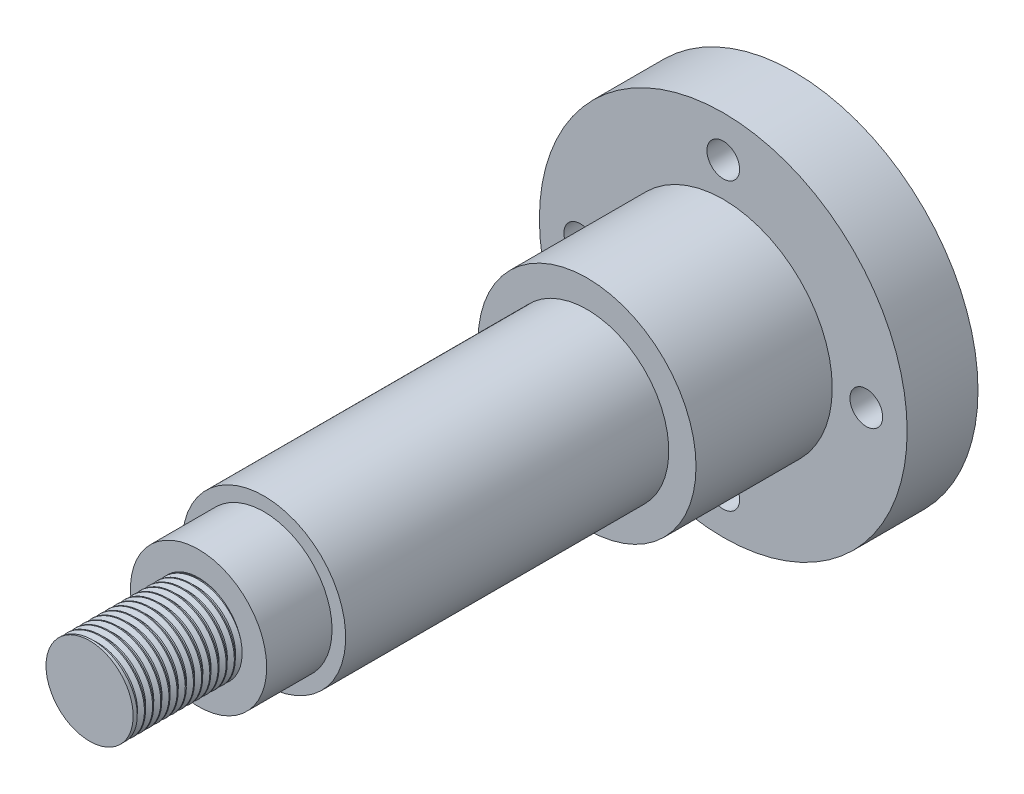
from build123d import *

# Parameters (mm, degrees)
BOSS_EXTRUDE1_DEPTH      = 10
BOSS_EXTRUDE1_DEPTH_BACK = 3
SKETCH3_R                = 33.75
SKETCH4_R                = 20
BOSS_EXTRUDE2_DEPTH      = 25
SKETCH5_R                = 15
BOSS_EXTRUDE3_DEPTH      = 59.3
SKETCH6_R                = 12.5
BOSS_EXTRUDE4_DEPTH      = 12
SKETCH7_R                = 3
CUT_EXTRUDE1_DEPTH       = 40
SKETCH8_R                = 8
BOSS_EXTRUDE5_DEPTH      = 20
THREAD1_PITCH            = 1.5


with BuildPart() as part:
    # Sketch3 → Boss-Extrude1 (new, two sides: drawn at the far end of the back side and taken through both)
    with BuildSketch(Plane.XY.offset(-BOSS_EXTRUDE1_DEPTH_BACK)):
        Circle(SKETCH3_R)
    extrude(amount=BOSS_EXTRUDE1_DEPTH + BOSS_EXTRUDE1_DEPTH_BACK)

    # Sketch4 → Boss-Extrude2 (add)
    with BuildSketch(Plane.XY.offset(10)):
        Circle(SKETCH4_R)
    extrude(amount=BOSS_EXTRUDE2_DEPTH)

    # Sketch5 → Boss-Extrude3 (add)
    with BuildSketch(Plane.XY.offset(35)):
        with Locations(Location((0, 0, 0), (0, 0, 180))):
            Circle(SKETCH5_R)
    extrude(amount=BOSS_EXTRUDE3_DEPTH)

    # Sketch6 → Boss-Extrude4 (add)
    with BuildSketch(Plane.XY.offset(94.3)):
        Circle(SKETCH6_R)
    extrude(amount=BOSS_EXTRUDE4_DEPTH)

    # Sketch7 → Cut-Extrude1 (cut)
    with BuildSketch(Plane.XY.offset(10)):
        with Locations((0, 26.25)):
            Circle(SKETCH7_R)
        with Locations((26.25, 0)):
            Circle(SKETCH7_R)
        with Locations((0, -26.25)):
            Circle(SKETCH7_R)
        with Locations((-26.25, 0)):
            Circle(SKETCH7_R)
    extrude(amount=-CUT_EXTRUDE1_DEPTH, mode=Mode.SUBTRACT)

    # Sketch8 → Boss-Extrude5 (add)
    with BuildSketch(Plane.XY.offset(106.3)):
        Circle(SKETCH8_R)
    extrude(amount=BOSS_EXTRUDE5_DEPTH)

    # Thread1: the profile of Thread Profile1 profile screwed along a right-hand helix of 13.333333 turns, 8 arcs to a turn; built about Z, then put on its axis
    thread1_z = Axis((0, 0, 0), (0, 0, 1))
    thread1_corners = [(8.0003, 0, -0.000173205), (8.0003, 0, 1.312673201), (7.188101188, 0, 0.843749998), (7.188101188, 0, 0.468749998)]
    with BuildLine(mode=Mode.PRIVATE) as thread1_profile:
        Line(thread1_corners[0], thread1_corners[1])
        Line(thread1_corners[1], thread1_corners[2])
        Line(thread1_corners[2], thread1_corners[3])
        Line(thread1_corners[3], thread1_corners[0])
    thread1_cap = Face(thread1_profile.wire())
    thread1_turn_angles = [0, 22.5, 45, 67.5, 90, 112.5, 135, 157.5, 180, 202.5, 225, 247.5, 270, 292.5, 315, 337.5, 360]
    thread1_turn_weights = [1, 0.9238795325112867, 1, 0.9238795325112867, 1, 0.9238795325112867, 1, 0.9238795325112867, 1, 0.9238795325112867, 1, 0.9238795325112867, 1, 0.9238795325112867, 1, 0.9238795325112867, 1]
    thread1_turn_rails = [Edge.make_bspline([Vector(p[0], p[1], 0).rotate(thread1_z, thread1_turn_angles[k]) / thread1_turn_weights[k] + Vector(0, 0, p[2] + THREAD1_PITCH * thread1_turn_angles[k] / 360) for k in range(17)], [0, 0, 0, 1, 1, 2, 2, 3, 3, 4, 4, 5, 5, 6, 6, 7, 7, 8, 8, 8], 2, thread1_turn_weights) for p in thread1_corners]
    thread1_turn_sides = [Face.make_surface_from_curves(thread1_turn_rails[p[0]], thread1_turn_rails[p[1]]) for p in [(0, 1), (1, 2), (2, 3), (3, 0)]]
    thread1_last_angles = [4680, 4702.5, 4725, 4747.5, 4770, 4785, 4800]
    thread1_last_weights = [1, 0.9238795325112867, 1, 0.9238795325112867, 1, 0.9659258262890703, 1]
    thread1_last_rails = [Edge.make_bspline([Vector(p[0], p[1], 0).rotate(thread1_z, thread1_last_angles[k]) / thread1_last_weights[k] + Vector(0, 0, p[2] + THREAD1_PITCH * thread1_last_angles[k] / 360) for k in range(7)], [0, 0, 0, 1, 1, 2, 2, 3, 3, 3], 2, thread1_last_weights) for p in thread1_corners]
    thread1_last_sides = [Face.make_surface_from_curves(thread1_last_rails[p[0]], thread1_last_rails[p[1]]) for p in [(0, 1), (1, 2), (2, 3), (3, 0)]]
    thread1 = Plane(origin=(0, 0, 126.3), x_dir=(-1, 0, 0), z_dir=(0, 0, -1)) * Solid(Shell([*[p.moved(Location((0, 0, THREAD1_PITCH * i))) for i in range(13) for p in thread1_turn_sides], *thread1_last_sides, thread1_cap, thread1_cap.rotate(thread1_z, 4800).moved(Location((0, 0, THREAD1_PITCH * 4800 / 360)))]))
    add(thread1, mode=Mode.SUBTRACT)


solid = part.part
